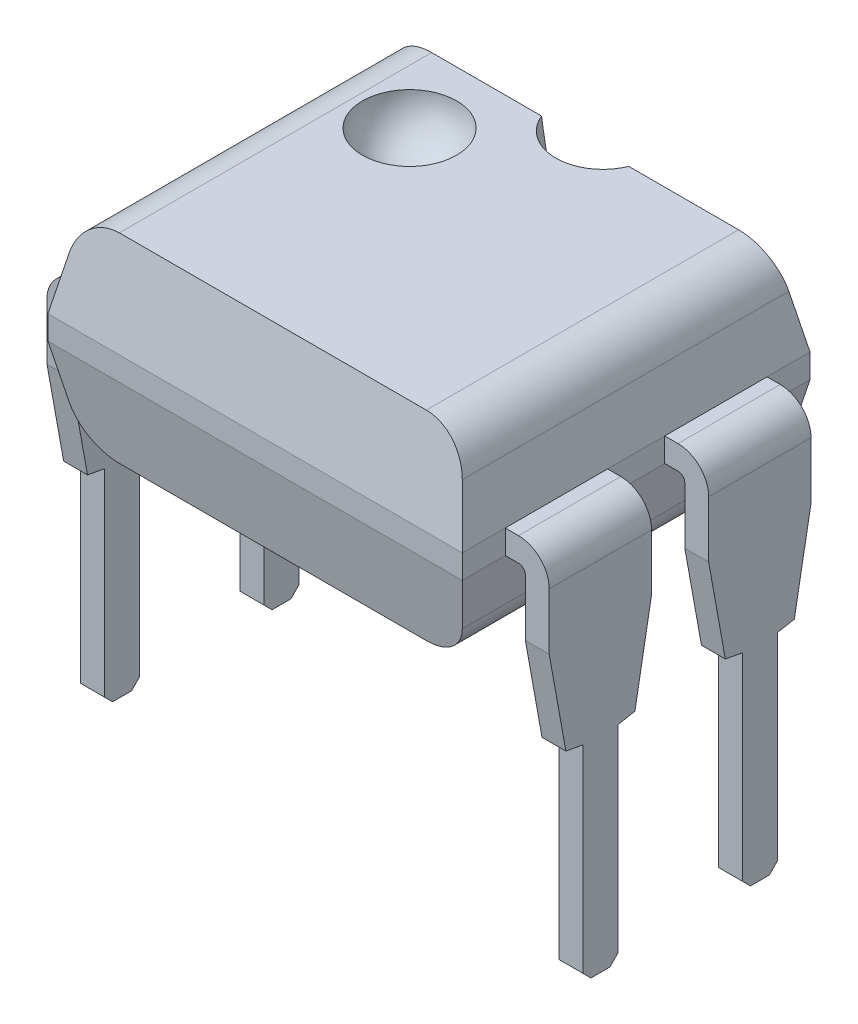
from build123d import *

# Parameters (mm, degrees)
BASE_EXTRUDE_DEPTH      = 4.04
BASE_EXTRUDE_DEPTH_BACK = 1.5
SKETCH1_W               = 6.6
SKETCH1_H               = 3.18
SKETCH2_OUTSIDE_W       = 10.436
SKETCH2_OUTSIDE_H       = 7.016
CUT_EXTRUDE1_DEPTH      = 10.990985937
SKETCH3_OUTSIDE_W       = 9.376
SKETCH3_OUTSIDE_H       = 7.016
CUT_EXTRUDE2_DEPTH      = 9.857635125
SKETCH5_W               = 1.63
SKETCH5_H               = 0.38
BOSS_EXTRUDE3_DEPTH     = 0.7
SKETCH6_W               = 0.38
SKETCH6_H               = 1.63
BOSS_EXTRUDE4_DEPTH     = 2.53
SKETCH4_W               = 0.38
SKETCH4_H               = 0.56
BOSS_EXTRUDE5_DEPTH     = 3.28
CUT_EXTRUDE5_DEPTH      = 0.38
FILLET1_R               = 0.49
FILLET2_R               = 0.11
FILLET1_OF_MIRROR1_R    = 0.49
FILLET2_OF_MIRROR1_R    = 0.11
SKETCH10_R              = 0.75
CUT_EXTRUDE6_DEPTH      = 0.7


# Read off the part's stored shape, not the designer's step: Mirror2
with BuildPart() as part:
    # Sketch1 → Base-Extrude (new, two sides: drawn at the far end of the back side and taken through both)
    with BuildSketch(Plane.XY.offset(-BASE_EXTRUDE_DEPTH_BACK)):
        with Locations((3.81, 2.72)):
            Rectangle(SKETCH1_W, SKETCH1_H)
    extrude(amount=BASE_EXTRUDE_DEPTH + BASE_EXTRUDE_DEPTH_BACK)

    # Sketch2 outside → Cut-Extrude1 (cut, through all)
    with BuildSketch(Plane.XY.offset(4.04)):
        with Locations((3.81, 2.72)):
            Rectangle(SKETCH2_OUTSIDE_W, SKETCH2_OUTSIDE_H)
        with BuildLine():
            Line((0.51, 2.91), (0.679431307, 3.748623606))
            ThreePointArc((0.679431307, 3.748623606), (0.922305346, 4.151773257), (1.365567952, 4.31))
            Line((1.365567952, 4.31), (6.254432048, 4.31))
            ThreePointArc((6.254432048, 4.31), (6.697694654, 4.151773257), (6.940568693, 3.748623606))
            Line((6.940568693, 3.748623606), (7.11, 2.91))
            Line((7.11, 2.91), (7.11, 2.53))
            Line((7.11, 2.53), (6.940568693, 1.691376394))
            ThreePointArc((6.940568693, 1.691376394), (6.697694654, 1.288226743), (6.254432048, 1.13))
            Line((6.254432048, 1.13), (1.365567952, 1.13))
            ThreePointArc((1.365567952, 1.13), (0.922305346, 1.288226743), (0.679431307, 1.691376394))
            Line((0.679431307, 1.691376394), (0.51, 2.53))
            Line((0.51, 2.53), (0.51, 2.91))
        make_face(mode=Mode.SUBTRACT)
    extrude(amount=-CUT_EXTRUDE1_DEPTH, mode=Mode.SUBTRACT)

    # Sketch3 outside → Cut-Extrude2 (cut, through all)
    with BuildSketch(Plane(origin=(7.11, 0, 0), x_dir=(0, 0, -1), z_dir=(1, 0, 0))):
        with Locations((-1.27, 2.72)):
            Rectangle(SKETCH3_OUTSIDE_W, SKETCH3_OUTSIDE_H)
        Polygon((1.5, 2.91), (1.134316679, 4.72), (-3.674316679, 4.72), (-4.04, 2.91), (-4.04, 2.53), (-3.674316679, 0.72), (1.134316679, 0.72), (1.5, 2.53), align=None, mode=Mode.SUBTRACT)
    extrude(amount=-CUT_EXTRUDE2_DEPTH, mode=Mode.SUBTRACT)

    # Sketch5 → Boss-Extrude3 (add)
    with BuildSketch(Plane.ZY.offset(-0.51)):
        with Locations((0, 2.72)):
            Rectangle(SKETCH5_W, SKETCH5_H)
    boss_extrude3 = extrude(amount=BOSS_EXTRUDE3_DEPTH)

    # Sketch6 → Boss-Extrude4 (add)
    with BuildSketch(Plane.XZ.offset(-2.53)):
        Rectangle(SKETCH6_W, SKETCH6_H)
    boss_extrude4 = extrude(amount=BOSS_EXTRUDE4_DEPTH)

    # Sketch4 → Boss-Extrude5 (add)
    with BuildSketch(Plane(origin=(0, 0, 0), x_dir=(1, 0, 0), z_dir=(0, 1, 0))):
        Rectangle(SKETCH4_W, SKETCH4_H)
    boss_extrude5 = extrude(amount=-BOSS_EXTRUDE5_DEPTH)

    # Sketch7 → Cut-Extrude5 (cut)
    with BuildSketch(Plane.ZY.offset(0.19)):
        Polygon((0.815, 1.52), (0.55, 0.05), (0.28, 0), (0.28, -3.15), (0.15, -3.28), (-0.15, -3.28), (-0.28, -3.15), (-0.28, 0), (-0.55, 0.05), (-0.815, 1.52), (-0.815, -3.78), (0.815, -3.78), align=None)
    cut_extrude5 = extrude(amount=-CUT_EXTRUDE5_DEPTH, mode=Mode.SUBTRACT)

    # Fillet1
    fillet1_edges = [part.edges().sort_by_distance(p)[0] for p in [
        (-0.19, 2.91, 0),
    ]]
    fillet(fillet1_edges, radius=FILLET1_R)

    # Fillet2
    fillet2_edges = [part.edges().sort_by_distance(p)[0] for p in [
        (0.19, 2.53, 0),
    ]]
    fillet(fillet2_edges, radius=FILLET2_R)

    # Mirror1: Boss-Extrude3, Boss-Extrude4, Boss-Extrude5, Cut-Extrude5 across plane
    add(boss_extrude3.mirror(Plane.ZY.offset(-3.81)))
    add(boss_extrude4.mirror(Plane.ZY.offset(-3.81)))
    add(boss_extrude5.mirror(Plane.ZY.offset(-3.81)))
    add(cut_extrude5.mirror(Plane.ZY.offset(-3.81)), mode=Mode.SUBTRACT)

    # Fillet1 of Mirror1
    fillet1_of_mirror1_edges = [part.edges().sort_by_distance(p)[0] for p in [
        (7.81, 2.91, 0),
    ]]
    fillet(fillet1_of_mirror1_edges, radius=FILLET1_OF_MIRROR1_R)

    # Fillet2 of Mirror1
    fillet2_of_mirror1_edges = [part.edges().sort_by_distance(p)[0] for p in [
        (7.43, 2.53, 0),
    ]]
    fillet(fillet2_of_mirror1_edges, radius=FILLET2_OF_MIRROR1_R)

    # Mirror2: part across plane


with BuildPart() as part_1:
    add(part.part)
    add(part.part.mirror(Plane(origin=(0, 0, 1.27), x_dir=(1, 0, 0), z_dir=(0, 0, -1))))

    # Sketch9 → Cut-Revolve1 (revolve, cut)
    with BuildSketch(Plane.XY):
        with BuildLine():
            Line((2.980337349, 4.31), (2.230337349, 4.31))
            Line((2.230337349, 4.31), (2.230337349, 3.56))
            ThreePointArc((2.230337349, 3.56), (2.760667435, 3.779669914), (2.980337349, 4.31))
        make_face()
    revolve(axis=Axis((2.230337349, 5.149947403, 0), (0, -1, 0)), mode=Mode.SUBTRACT)

    # Sketch10 → Cut-Extrude6 (cut)
    with BuildSketch(Plane(origin=(0, 4.31, 0), x_dir=(-1, 0, 0), z_dir=(0, 1, 0))):
        with Locations((-3.81, -1.5)):
            Circle(SKETCH10_R)
    extrude(amount=-CUT_EXTRUDE6_DEPTH, mode=Mode.SUBTRACT)


solid = part_1.part
